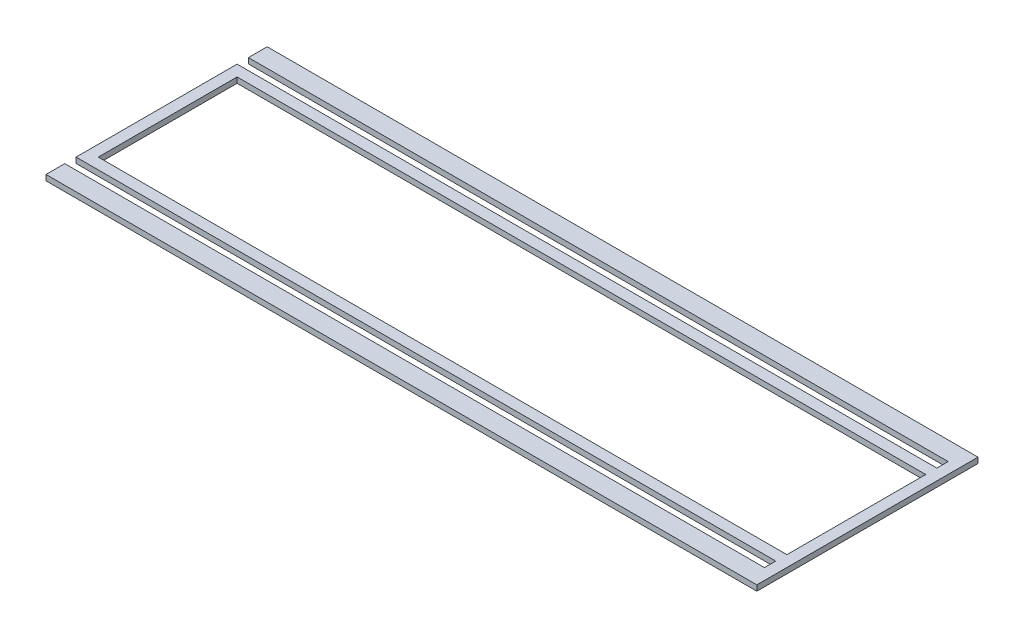
from build123d import *

# Parameters (mm, degrees)
SKETCH1_W           = 393.7
SKETCH1_H           = 79.36865
BOSS_EXTRUDE1_DEPTH = 1.5875


with BuildPart() as part:
    # Sketch1 → Boss-Extrude1 (new, symmetric)
    with BuildSketch(Plane(origin=(0, 0, 0), x_dir=(1, 0, 0), z_dir=(0, 1, 0))):
        Polygon((196.85, 46.034325), (-203.2, 46.034325), (-203.2, -46.034325), (196.85, -46.034325), (196.85, -52.511325), (-203.2, -52.511325), (-203.2, -63.22695), (190.5, -63.22695), (203.2, -63.22695), (203.2, 63.22695), (190.5, 63.22695), (-203.2, 63.22695), (-203.2, 52.511325), (196.85, 52.511325), align=None)
        Rectangle(SKETCH1_W, SKETCH1_H, mode=Mode.SUBTRACT)
    extrude(amount=BOSS_EXTRUDE1_DEPTH, both=True)


solid = part.part
